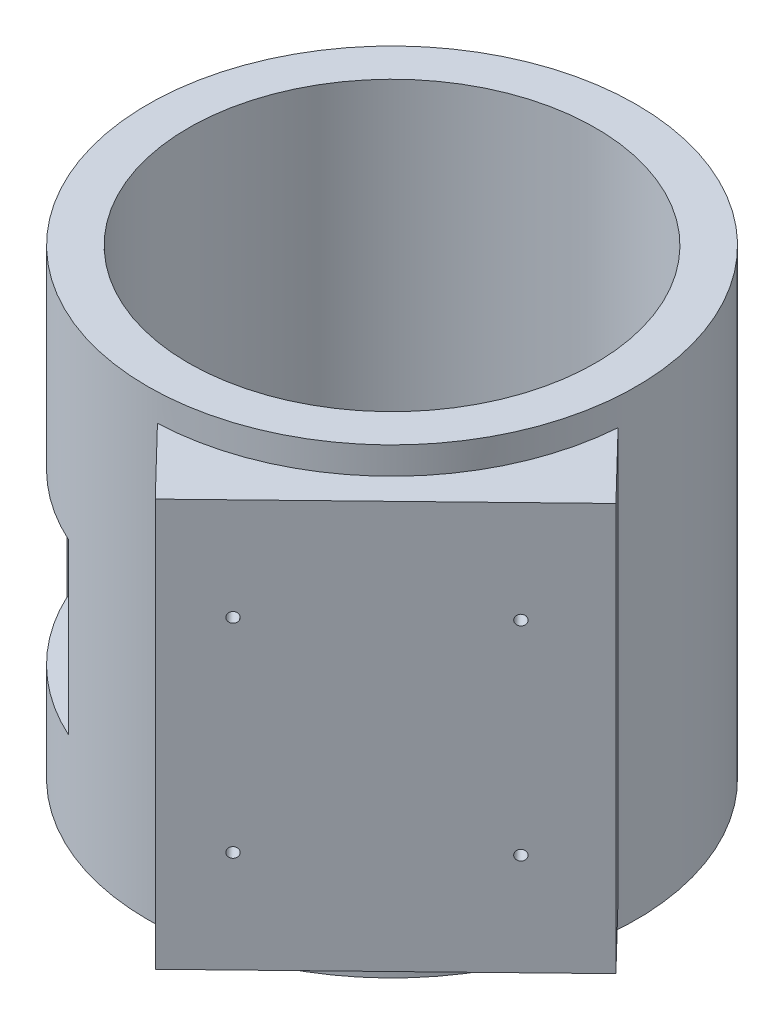
from build123d import *

# Parameters (mm, degrees)
SKETCH_2_R               = 120
SKETCH_2_R_2             = 100
EXTRUDE_1_DEPTH          = 226.75
CUT_EXTRUDE_1_DEPTH      = 100
EXTRUDE_3_REACH          = 1974
CUT_EXTRUDE_2_DEPTH      = 296.932481141
CUT_EXTRUDE_2_DEPTH_BACK = 296.932481141
SKETCH_5_R               = 100
SKETCH_6_W               = 160
SKETCH_6_H               = 200
EXTRUDE_4_DEPTH          = 10
CUT_EXTRUDE_4_REACH      = 381.841
SKETCH_7_R               = 2.5
SKETCH_9_W               = 83
SKETCH_9_H               = 83
CUT_EXTRUDE_8_DEPTH      = 29
SKETCH_10_R              = 5
CUT_EXTRUDE_9_DEPTH      = 20


with BuildPart() as part:
    # 草图2 → 凸台-拉伸1 (new body)
    with BuildSketch(Plane(origin=(0, 0, 0), x_dir=(1, 0, 0), z_dir=(0, 1, 0))):
        Circle(SKETCH_2_R)
        Circle(SKETCH_2_R_2, mode=Mode.SUBTRACT)
    extrude(amount=EXTRUDE_1_DEPTH)

    # 草图3 → 切除-拉伸1 (cut)
    with BuildSketch(Plane(origin=(1112.773046884, 1150.451956698, -902.504604014), x_dir=(0.07790668401541614, 0.9941079281715651, -0.07536561372509747), z_dir=(0.6952882558092205, 0, 0.7187309937200231))):
        Polygon((-1087.852842581, 1332.217286099), (-1094.898502926, 1396.83430143), (-1293.72008856, 1375.155346523), (-1286.674428215, 1310.538331192), (-1283.422584979, 1280.715093347), (-1276.376924635, 1216.098078016), (-1077.555339, 1237.777032923), (-1084.600999345, 1302.394048254), align=None)
    extrude(amount=-CUT_EXTRUDE_1_DEPTH, mode=Mode.SUBTRACT)

    # 草图4 → 凸台-拉伸3 (add, up to next)
    with BuildSketch(Plane(origin=(1112.773046884, 1150.451956698, -902.504604014), x_dir=(0.07790668401541614, 0.9941079281715651, -0.07536561372509747), z_dir=(0.6952882558092205, 0, 0.7187309937200231)), mode=Mode.PRIVATE) as extrude_3_sk1:
        Polygon((-1293.72008856, 1375.155346523), (-1094.898502926, 1396.83430143), (-1077.555339, 1237.777032923), (-1276.376924635, 1216.098078016), align=None)
        Polygon((-1097.793921863, 1331.133338354), (-1103.755634462, 1385.809274403), (-1282.695061533, 1366.298214987), (-1276.733348934, 1311.622278937), (-1273.481505698, 1281.799041092), (-1267.519793098, 1227.123105043), (-1088.580366027, 1246.634164459), (-1094.542078627, 1301.310100509), align=None, mode=Mode.SUBTRACT)
    extrude_3_tool1 = extrude(extrude_3_sk1.sketch, amount=-EXTRUDE_3_REACH, mode=Mode.PRIVATE) - part.part
    add(extrude_3_tool1.solids().sort_by_distance((31.465513, 113.414214, 143.534089))[0])

    # 草图5 → 切除-拉伸2 (cut, two sides: drawn at the far end of the back side and taken through both)
    with BuildSketch(Plane(origin=(0, 213.414213562, 0), x_dir=(1, 0, 0), z_dir=(0, 1, 0)).offset(-CUT_EXTRUDE_2_DEPTH_BACK)):
        Circle(SKETCH_5_R)
    extrude(amount=CUT_EXTRUDE_2_DEPTH + CUT_EXTRUDE_2_DEPTH_BACK, mode=Mode.SUBTRACT)

    # 草图6 → 凸台-拉伸4 (add)
    with BuildSketch(Plane(origin=(86.938843506, 0, 89.870123455), x_dir=(0.7187309937200231, 0, -0.6952882558092205), z_dir=(0.6952882558092205, 0, 0.7187309937200231))):
        with Locations((0, 113.414213562)):
            Rectangle(SKETCH_6_W, SKETCH_6_H)
    extrude(amount=EXTRUDE_4_DEPTH)

    # 草图7 → 切除-拉伸4 (cut, up to next)
    with BuildSketch(Plane(origin=(93.891726064, 0, 97.057433392), x_dir=(0.7187309937200231, 0, -0.6952882558092206), z_dir=(0.6952882558092206, 0, 0.7187309937200231)), mode=Mode.PRIVATE) as cut_extrude_4_sk1:
        with Locations((47, 163.414213562)):
            Circle(SKETCH_7_R)
    cut_extrude_4_tool1 = extrude(cut_extrude_4_sk1.sketch, amount=-CUT_EXTRUDE_4_REACH, mode=Mode.PRIVATE) & part.part
    # 草图7 → 切除-拉伸4 (cut, up to next)
    with BuildSketch(Plane(origin=(93.891726064, 0, 97.057433392), x_dir=(0.7187309937200231, 0, -0.6952882558092206), z_dir=(0.6952882558092206, 0, 0.7187309937200231)), mode=Mode.PRIVATE) as cut_extrude_4_sk2:
        with Locations((-53, 163.414213562)):
            Circle(SKETCH_7_R)
    cut_extrude_4_tool2 = extrude(cut_extrude_4_sk2.sketch, amount=-CUT_EXTRUDE_4_REACH, mode=Mode.PRIVATE) & part.part
    # 草图7 → 切除-拉伸4 (cut, up to next)
    with BuildSketch(Plane(origin=(93.891726064, 0, 97.057433392), x_dir=(0.7187309937200231, 0, -0.6952882558092206), z_dir=(0.6952882558092206, 0, 0.7187309937200231)), mode=Mode.PRIVATE) as cut_extrude_4_sk3:
        with Locations((-53, 63.414213562)):
            Circle(SKETCH_7_R)
    cut_extrude_4_tool3 = extrude(cut_extrude_4_sk3.sketch, amount=-CUT_EXTRUDE_4_REACH, mode=Mode.PRIVATE) & part.part
    # 草图7 → 切除-拉伸4 (cut, up to next)
    with BuildSketch(Plane(origin=(93.891726064, 0, 97.057433392), x_dir=(0.7187309937200231, 0, -0.6952882558092206), z_dir=(0.6952882558092206, 0, 0.7187309937200231)), mode=Mode.PRIVATE) as cut_extrude_4_sk4:
        with Locations((47, 63.414213562)):
            Circle(SKETCH_7_R)
    cut_extrude_4_tool4 = extrude(cut_extrude_4_sk4.sketch, amount=-CUT_EXTRUDE_4_REACH, mode=Mode.PRIVATE) & part.part
    add(cut_extrude_4_tool1.solids().sort_by_distance((127.672083, 163.414214, 64.378885))[0], mode=Mode.SUBTRACT)
    add(cut_extrude_4_tool2.solids().sort_by_distance((55.798983, 163.414214, 133.907711))[0], mode=Mode.SUBTRACT)
    add(cut_extrude_4_tool3.solids().sort_by_distance((55.798983, 63.414214, 133.907711))[0], mode=Mode.SUBTRACT)
    add(cut_extrude_4_tool4.solids().sort_by_distance((127.672083, 63.414214, 64.378885))[0], mode=Mode.SUBTRACT)

    # 草图9 → 切除-拉伸8 (cut)
    with BuildSketch(Plane(origin=(-86.247719246, 0, 83.434590697), x_dir=(0.6952882558092207, 0, 0.7187309937200231), z_dir=(-0.7187309937200231, 0, 0.6952882558092207))):
        with Locations((2.54, 89.91)):
            Rectangle(SKETCH_9_W, SKETCH_9_H)
    extrude(amount=-CUT_EXTRUDE_8_DEPTH, mode=Mode.SUBTRACT)

    # 草图10 → 切除-拉伸9 (cut)
    with BuildSketch(Plane.XZ):
        with Locations((-74.900526233, 73.569836582)):
            Circle(SKETCH_10_R)
        with Locations((73.510292028, 78.492135127)):
            Circle(SKETCH_10_R)
        with Locations((78.432590573, -69.918683134)):
            Circle(SKETCH_10_R)
        with Locations((-69.978227689, -74.840981679)):
            Circle(SKETCH_10_R)
    extrude(amount=-CUT_EXTRUDE_9_DEPTH, mode=Mode.SUBTRACT)


solid = part.part
